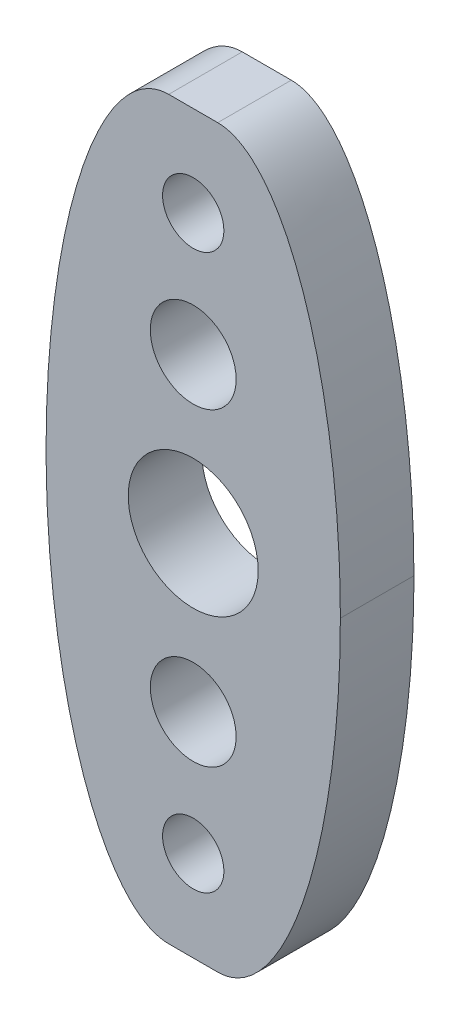
from build123d import *

# Parameters (mm, degrees)
SKETCH_1_W      = 12
SKETCH_1_H      = 30
SKETCH_1_R      = 2.65
SKETCH_1_R_2    = 1.25
SKETCH_1_R_3    = 1.75
EXTRUDE_1_DEPTH = 3
FILLET_1_SIZE   = 5
FILLET_1_SIZE_2 = 15
FILLET_2_SIZE   = 5
FILLET_2_SIZE_2 = 15
FILLET_3_SIZE   = 15
FILLET_3_SIZE_2 = 5
FILLET_4_SIZE   = 5
FILLET_4_SIZE_2 = 15


with BuildPart() as part:
    # 草图1 → 凸台-拉伸1 (new body)
    with BuildSketch(Plane.XY):
        with Locations((-4.763664969, 12.565714772)):
            Rectangle(SKETCH_1_W, SKETCH_1_H)
        with Locations((-4.763664969, 12.565714772)):
            Circle(SKETCH_1_R, mode=Mode.SUBTRACT)
        with Locations((-4.763664969, 23.875723392)):
            Circle(SKETCH_1_R_2, mode=Mode.SUBTRACT)
        with Locations((-4.763664969, 18.875154811)):
            Circle(SKETCH_1_R_3, mode=Mode.SUBTRACT)
        with Locations(Location((-4.763664969, 1.255706152, 0), (0, 0, 180))):
            Circle(SKETCH_1_R_2, mode=Mode.SUBTRACT)
        with Locations(Location((-4.763664969, 6.256274734, 0), (0, 0, 180))):
            Circle(SKETCH_1_R_3, mode=Mode.SUBTRACT)
    extrude(amount=EXTRUDE_1_DEPTH)

    # 圆角1
    # an asymmetric fillet: 15, 5 mm, written as the material it takes off along each edge
    with BuildSketch(Plane(origin=(-10.763664969, 27.565714772, -37.5), x_dir=(1, 0, 0), z_dir=(0, 0, 1))) as fillet_1_piece_1:
        with BuildLine():
            Bezier((FILLET_1_SIZE, 0), (0, 0), (0, -FILLET_1_SIZE_2), weights=[1, 0.707106781, 1])
            Line((0, -FILLET_1_SIZE_2), (0, 0))
            Line((0, 0), (FILLET_1_SIZE, 0))
        make_face()
    extrude(amount=78, mode=Mode.SUBTRACT)

    # 圆角2
    # an asymmetric fillet: 15, 5 mm, written as the material it takes off along each edge
    with BuildSketch(Plane(origin=(1.236335031, 27.565714772, -37.5), x_dir=(-1, 0, 0), z_dir=(0, 0, 1))) as fillet_2_piece_1:
        with BuildLine():
            Bezier((FILLET_2_SIZE, 0), (0, 0), (0, FILLET_2_SIZE_2), weights=[1, 0.707106781, 1])
            Line((0, FILLET_2_SIZE_2), (0, 0))
            Line((0, 0), (FILLET_2_SIZE, 0))
        make_face()
    extrude(amount=78, mode=Mode.SUBTRACT)

    # 圆角3
    # an asymmetric fillet: 15, 5 mm, written as the material it takes off along each edge
    with BuildSketch(Plane(origin=(-10.763664969, -2.434285228, -37.5), x_dir=(0, 1, 0), z_dir=(0, 0, 1))) as fillet_3_piece_1:
        with BuildLine():
            Bezier((FILLET_3_SIZE, 0), (0, 0), (0, -FILLET_3_SIZE_2), weights=[1, 0.707106781, 1])
            Line((0, -FILLET_3_SIZE_2), (0, 0))
            Line((0, 0), (FILLET_3_SIZE, 0))
        make_face()
    extrude(amount=78, mode=Mode.SUBTRACT)

    # 圆角4
    # an asymmetric fillet: 15, 5 mm, written as the material it takes off along each edge
    with BuildSketch(Plane(origin=(1.236335031, -2.434285228, -37.5), x_dir=(-1, 0, 0), z_dir=(0, 0, 1))) as fillet_4_piece_1:
        with BuildLine():
            Bezier((FILLET_4_SIZE, 0), (0, 0), (0, -FILLET_4_SIZE_2), weights=[1, 0.707106781, 1])
            Line((0, -FILLET_4_SIZE_2), (0, 0))
            Line((0, 0), (FILLET_4_SIZE, 0))
        make_face()
    extrude(amount=78, mode=Mode.SUBTRACT)


solid = part.part
